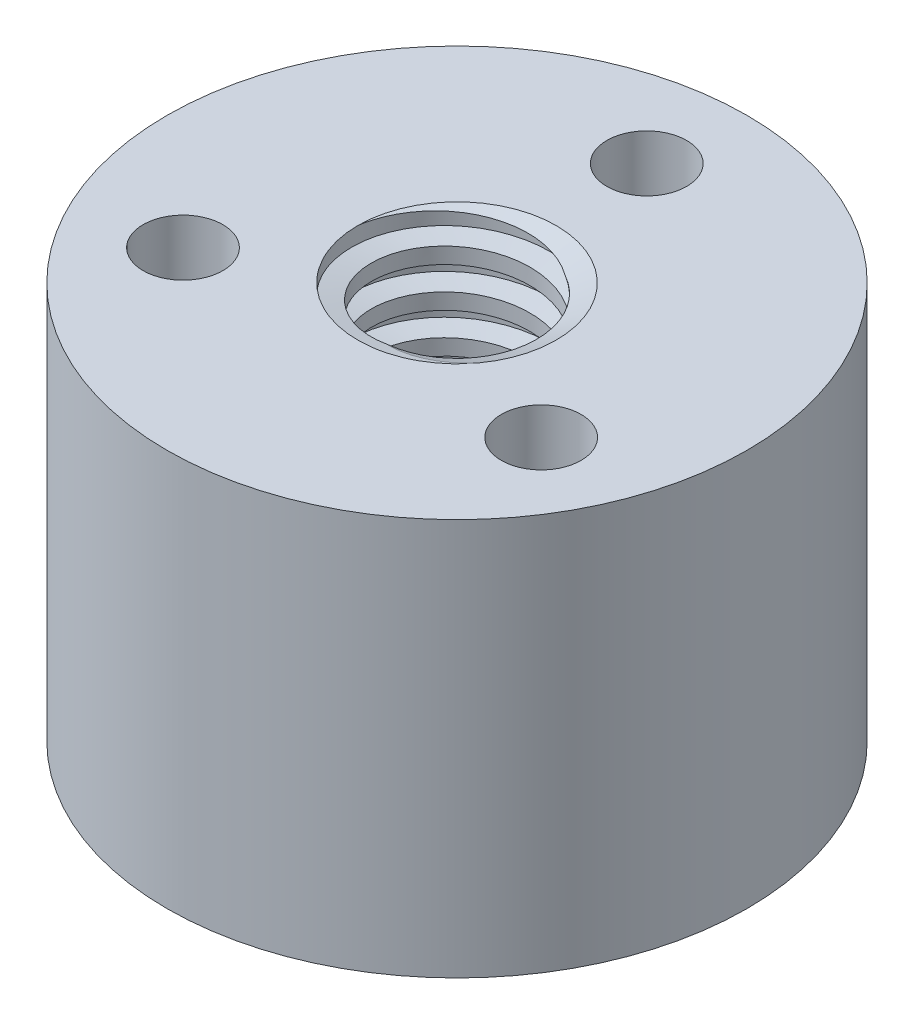
from build123d import *

# Parameters (mm, degrees)
SKETCH1_R                   = 18.56105
SKETCH1_R_2                 = 5.0927
BOSS_EXTRUDE1_DEPTH         = 25.4
CUT_SWEEP2_PITCH            = 2.54
F_1_4_20_TAPPED_HOLE1_D     = 5.1054
F_1_4_20_TAPPED_HOLE1_DEPTH = 21.59
F_1_4_20_TAPPED_HOLE1_TIP   = 1.533816902


with BuildPart() as part:
    # Sketch1 → Boss-Extrude1 (new body)
    with BuildSketch(Plane(origin=(0, 0, 0), x_dir=(1, 0, 0), z_dir=(0, 1, 0))):
        with Locations(Location((0, 0, 0), (0, 0, 270))):
            Circle(SKETCH1_R)
        with Locations(Location((0, 0, 0), (0, 0, 270))):
            Circle(SKETCH1_R_2, mode=Mode.SUBTRACT)
    extrude(amount=BOSS_EXTRUDE1_DEPTH)

    # Cut-Sweep2: arcs per turn and ends read off the stored shape
    # Cut-Sweep2: the profile of Sketch9 screwed along a right-hand helix through 15 turns, 10 arcs to a turn; built about Z, then put on its axis
    cut_sweep2_z = Axis((0, 0, 0), (0, 0, 1))
    cut_sweep2_corners = [(6.350000003, 0, -1.2867e-05), (6.350000003, 0, 1.015987133), (5.080000003, 0, 1.269987133), (5.080000003, 0, -0.254012867)]
    with BuildLine(mode=Mode.PRIVATE) as cut_sweep2_profile:
        Line(cut_sweep2_corners[0], cut_sweep2_corners[1])
        Line(cut_sweep2_corners[1], cut_sweep2_corners[2])
        Line(cut_sweep2_corners[2], cut_sweep2_corners[3])
        Line(cut_sweep2_corners[3], cut_sweep2_corners[0])
    cut_sweep2_cap = Face(cut_sweep2_profile.wire())
    cut_sweep2_turn_angles = [0, 18, 36, 54, 72, 90, 108, 126, 144, 162, 180, 198, 216, 234, 252, 270, 288, 306, 324, 342, 360]
    cut_sweep2_turn_weights = [1, 0.9510565162951535, 1, 0.9510565162951535, 1, 0.9510565162951535, 1, 0.9510565162951535, 1, 0.9510565162951535, 1, 0.9510565162951535, 1, 0.9510565162951535, 1, 0.9510565162951535, 1, 0.9510565162951535, 1, 0.9510565162951535, 1]
    cut_sweep2_turn_rails = [Edge.make_bspline([Vector(p[0], p[1], 0).rotate(cut_sweep2_z, cut_sweep2_turn_angles[k]) / cut_sweep2_turn_weights[k] + Vector(0, 0, p[2] + CUT_SWEEP2_PITCH * cut_sweep2_turn_angles[k] / 360) for k in range(21)], [0, 0, 0, 1, 1, 2, 2, 3, 3, 4, 4, 5, 5, 6, 6, 7, 7, 8, 8, 9, 9, 10, 10, 10], 2, cut_sweep2_turn_weights) for p in cut_sweep2_corners]
    cut_sweep2_turn_sides = [Face.make_surface_from_curves(cut_sweep2_turn_rails[p[0]], cut_sweep2_turn_rails[p[1]]) for p in [(0, 1), (1, 2), (2, 3), (3, 0)]]
    cut_sweep2 = Plane(origin=(0, 30.48, 0), x_dir=(-1, 0, 0), z_dir=(0, -1, 0)) * Solid(Shell([*[p.moved(Location((0, 0, CUT_SWEEP2_PITCH * i))) for i in range(15) for p in cut_sweep2_turn_sides], cut_sweep2_cap, cut_sweep2_cap.rotate(cut_sweep2_z, 5400).moved(Location((0, 0, CUT_SWEEP2_PITCH * 5400 / 360)))]))
    add(cut_sweep2, mode=Mode.SUBTRACT)

    # Sketch12 → Cut-Revolve2 (revolve, cut)
    with BuildSketch(Plane.XY):
        Polygon((0, 22.438946371), (6.35, 25.4), (0, 25.4), align=None)
        Polygon((0, 0), (6.35, 0), (0, 2.961053629), align=None)
    revolve(axis=Axis((0, 18.51610711, 0), (0, 1, 0)), mode=Mode.SUBTRACT)

    # 1/4-20 Tapped Hole1
    with Locations(Plane(origin=(0, 25.4, 0), x_dir=(-1, 0, 0), z_dir=(0, 1, 0))):
        with Locations((0.546091521, -12.688253783), (-11.259895866, 5.872063787), (10.716804345, 6.816189996)):
            Hole(F_1_4_20_TAPPED_HOLE1_D / 2, depth=F_1_4_20_TAPPED_HOLE1_DEPTH)
            with Locations((0, 0, -(F_1_4_20_TAPPED_HOLE1_DEPTH + F_1_4_20_TAPPED_HOLE1_TIP / 2))):  # 118° drill point
                Cone(0, F_1_4_20_TAPPED_HOLE1_D / 2, F_1_4_20_TAPPED_HOLE1_TIP, mode=Mode.SUBTRACT)


solid = part.part
